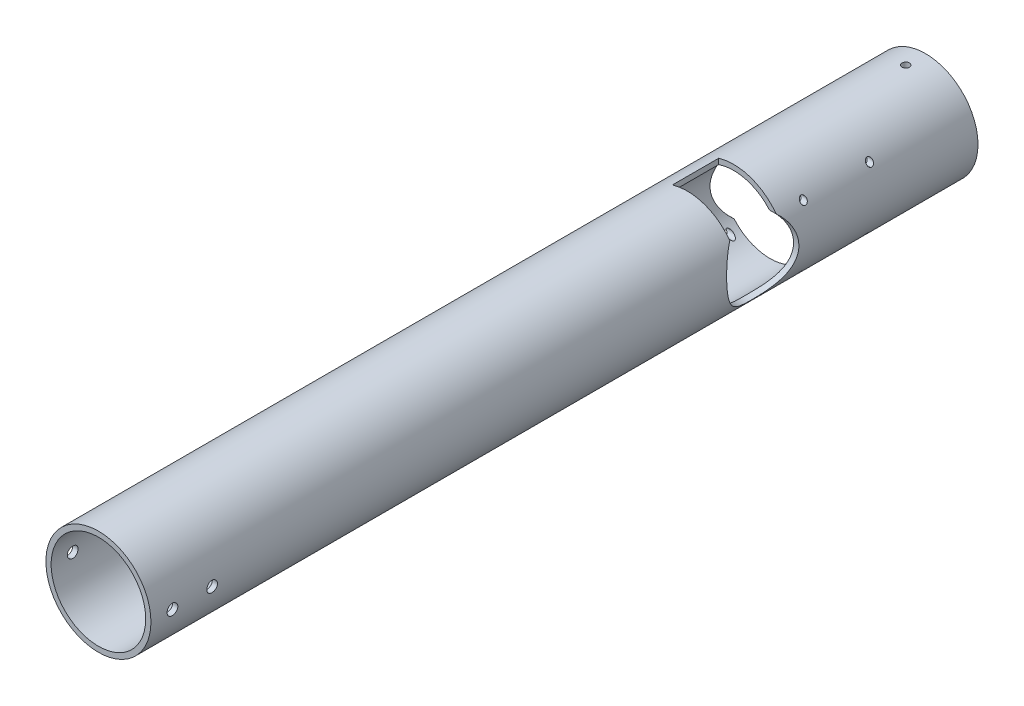
from build123d import *

# Parameters (mm, degrees)
BOSS_EXTRUDE1_DEPTH      = 250
BOSS_EXTRUDE1_DEPTH_BACK = 250
SKETCH1_R                = 31.75
SKETCH1_R_2              = 28.575
SKETCH2_R                = 21.75
CUT_EXTRUDE1_DEPTH       = 255.000246063
SKETCH3_R                = 21.75
CUT_EXTRUDE2_DEPTH       = 255.000246186
CUT_EXTRUDE4_START       = 9
SKETCH5_W                = 28
SKETCH5_H                = 22
CUT_EXTRUDE4_DEPTH       = 264.000246186
CUT_EXTRUDE5_START       = -9
SKETCH6_W                = 28
SKETCH6_H                = 22
CUT_EXTRUDE5_DEPTH       = 264.000246186
CUT_EXTRUDE8_DEPTH       = 255.000246186
CUT_EXTRUDE8_DEPTH_BACK  = 255.000246186
SKETCH11_R               = 2
CUT_EXTRUDE10_DEPTH      = 255.000246186
CUT_EXTRUDE10_DEPTH_BACK = 255.000246186
SKETCH12_R               = 3.25
CUT_EXTRUDE11_DEPTH      = 255.000246186
CUT_EXTRUDE11_DEPTH_BACK = 255.000246186
SKETCH13_R               = 2.25


with BuildPart() as part:
    # Sketch1 → Boss-Extrude1 (new, two sides: drawn at the far end of the back side and taken through both)
    with BuildSketch(Plane.XY.offset(-BOSS_EXTRUDE1_DEPTH_BACK)):
        Circle(SKETCH1_R)
        Circle(SKETCH1_R_2, mode=Mode.SUBTRACT)
    extrude(amount=BOSS_EXTRUDE1_DEPTH + BOSS_EXTRUDE1_DEPTH_BACK)

    # Sketch2 → Cut-Extrude1 (cut, through all)
    with BuildSketch(Plane(origin=(0, 0, 0), x_dir=(0, 0, -1), z_dir=(1, 0, 0))):
        with Locations((170, -2)):
            Circle(SKETCH2_R)
    extrude(amount=-CUT_EXTRUDE1_DEPTH, mode=Mode.SUBTRACT)

    # Sketch3 → Cut-Extrude2 (cut, through all)
    with BuildSketch(Plane(origin=(0, 0, 0), x_dir=(0, 0, -1), z_dir=(1, 0, 0))):
        with Locations((120, 2)):
            Circle(SKETCH3_R)
    extrude(amount=CUT_EXTRUDE2_DEPTH, mode=Mode.SUBTRACT)

    # Sketch5 → Cut-Extrude4 (cut, through all)
    with BuildSketch(Plane(origin=(0, 0, 0), x_dir=(0, 0, -1), z_dir=(1, 0, 0)).offset(CUT_EXTRUDE4_START)):
        with Locations((170, -23.75)):
            Rectangle(SKETCH5_W, SKETCH5_H)
    extrude(amount=-CUT_EXTRUDE4_DEPTH, mode=Mode.SUBTRACT)

    # Sketch6 → Cut-Extrude5 (cut, through all)
    with BuildSketch(Plane(origin=(0, 0, 0), x_dir=(0, 0, -1), z_dir=(1, 0, 0)).offset(CUT_EXTRUDE5_START)):
        with Locations((120, 23.75)):
            Rectangle(SKETCH6_W, SKETCH6_H)
    extrude(amount=CUT_EXTRUDE5_DEPTH, mode=Mode.SUBTRACT)

    # Sketch11 → Cut-Extrude8 (cut, two sides: drawn at the far end of the back side and taken through both)
    with BuildSketch(Plane(origin=(0, 0, 0), x_dir=(0, 0, -1), z_dir=(1, 0, 0)).offset(-CUT_EXTRUDE8_DEPTH_BACK)):
        with Locations((190, 18)):
            Circle(SKETCH11_R)
        with Locations((150, 18)):
            Circle(SKETCH11_R)
        with Locations((150, -22)):
            Circle(SKETCH11_R)
        with Locations((190, -22)):
            Circle(SKETCH11_R)
    extrude(amount=CUT_EXTRUDE8_DEPTH + CUT_EXTRUDE8_DEPTH_BACK, mode=Mode.SUBTRACT)

    # Sketch12 → Cut-Extrude10 (cut, two sides: drawn at the far end of the back side and taken through both)
    with BuildSketch(Plane(origin=(0, 0, 0), x_dir=(0, 0, -1), z_dir=(1, 0, 0)).offset(-CUT_EXTRUDE10_DEPTH_BACK)):
        with Locations((-213, 0)):
            Circle(SKETCH12_R)
        with Locations((-237, 0)):
            Circle(SKETCH12_R)
    extrude(amount=CUT_EXTRUDE10_DEPTH + CUT_EXTRUDE10_DEPTH_BACK, mode=Mode.SUBTRACT)

    # Sketch13 → Cut-Extrude11 (cut, two sides: drawn at the far end of the back side and taken through both)
    with BuildSketch(Plane(origin=(0, 0, 0), x_dir=(1, 0, 0), z_dir=(0, 1, 0)).offset(-CUT_EXTRUDE11_DEPTH_BACK)):
        with Locations((0, 238)):
            Circle(SKETCH13_R)
    extrude(amount=CUT_EXTRUDE11_DEPTH + CUT_EXTRUDE11_DEPTH_BACK, mode=Mode.SUBTRACT)


solid = part.part
